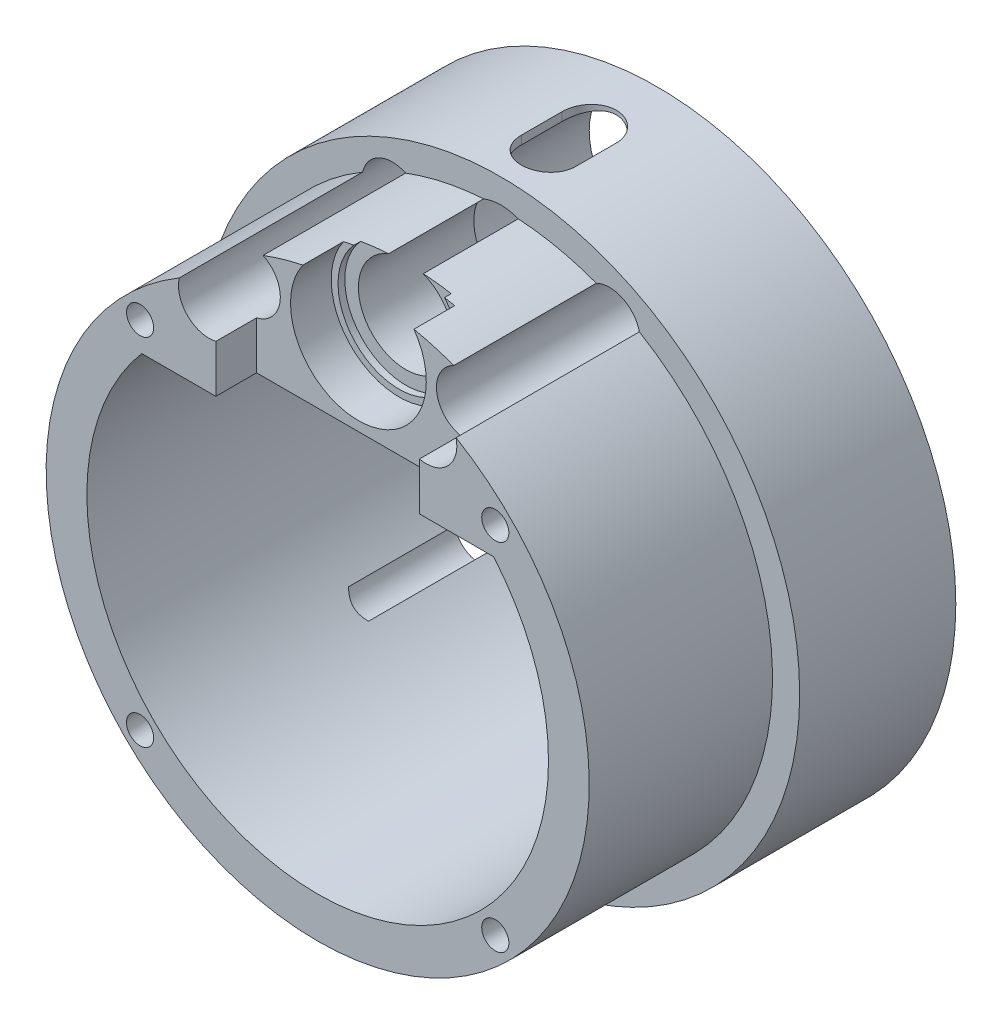
from build123d import *
from build123d.topology import SkipClean

# Parameters (mm, degrees)
SKIZZE1_R                                            = 22
AUFSATZ_LINEAR_AUSTRAGEN1_DEPTH                      = 1.5
AUFSATZ_LINEAR_START                                 = 13.5
SKIZZE1_6_R                                          = 20
AUFSATZ_LINEAR_AUSTRAGEN2_DEPTH                      = 13.5
SCHNITT_LINEAR_START                                 = 10.5
SCHNITT_LINEAR_AUSTRAGEN2_DEPTH                      = 3
SKIZZE1_9_R                                          = 5
SCHNITT_LINEAR_AUSTRAGEN3_DEPTH                      = 3
SCHNITT_LINEAR_START_2                               = 7
SCHNITT_LINEAR_AUSTRAGEN4_DEPTH                      = 0.5
SCHNITT_LINEAR_AUSTRAGEN5_DEPTH                      = 34.915335764
SCHNITT_LINEAR_AUSTRAGEN5_DEPTH_BACK                 = 34.915335764
SKIZZE1_11_R                                         = 3.5
SKIZZE3_R                                            = 0.75
SCHNITT_LINEAR_AUSTRAGEN6_DEPTH                      = 8
FORMSENKUNG_F_R_M3_SENKSCHRAUBE_MIT_INNE_D           = 2
FORMSENKUNG_F_R_M3_SENKSCHRAUBE_MIT_INNE_CSINK_D     = 3.7
FORMSENKUNG_F_R_M3_SENKSCHRAUBE_MIT_INNE_CSINK_ANGLE = 90
SKIZZE9_R                                            = 22
SKIZZE9_R_2                                          = 5
SKIZZE9_R_3                                          = 1.85
AUFSATZ_LINEAR_AUSTRAGEN5_DEPTH                      = 10
SKIZZE12_R                                           = 1.3
SCHNITT_LINEAR_AUSTRAGEN8_DEPTH                      = 40.912404087
SKIZZE12_3_R                                         = 2.25
SKIZZE12_3_R_2                                       = 1.3
SCHNITT_LINEAR_AUSTRAGEN9_DEPTH                      = 19
SCHNITT_LINEAR_AUSTRAGEN11_DEPTH                     = 5


# Read off the part's stored shape, not the designer's step: Schnitt-Linear austragen4
with BuildPart() as part:
    # Skizze1 → Aufsatz-Linear austragen1 (new body)
    with BuildSketch(Plane.XY):
        Circle(SKIZZE1_R)
        with BuildLine():
            Line((-12.961481397, 11), (12.961481397, 11))
            ThreePointArc((12.961481397, 11), (0, -17), (-12.961481397, 11))
        make_face(mode=Mode.SUBTRACT)
    extrude(amount=-AUFSATZ_LINEAR_AUSTRAGEN1_DEPTH)

    # Skizze1<6> → Aufsatz-Linear austragen2 (add)
    with BuildSketch(Plane.XY.offset(AUFSATZ_LINEAR_START)):
        Circle(SKIZZE1_6_R)
        with BuildLine():
            ThreePointArc((12.961481397, 11), (0, -17), (-12.961481397, 11))
            Line((-12.961481397, 11), (12.961481397, 11))
        make_face(mode=Mode.SUBTRACT)
    extrude(amount=-AUFSATZ_LINEAR_AUSTRAGEN2_DEPTH)

    # Skizze1<8> → Schnitt-Linear austragen2 (cut)
    with BuildSketch(Plane.XY.offset(SCHNITT_LINEAR_START)):
        with BuildLine():
            Line((-7.5, 18.540496218), (-7.5, 11))
            Line((-7.5, 11), (7.5, 11))
            Line((7.5, 11), (7.5, 18.540496218))
            ThreePointArc((7.5, 18.540496218), (0, 20), (-7.5, 18.540496218))
        make_face()
    extrude(amount=SCHNITT_LINEAR_AUSTRAGEN2_DEPTH, mode=Mode.SUBTRACT)

    # Skizze1<9> → Schnitt-Linear austragen3 (cut)
    with BuildSketch(Plane.XY.offset(SCHNITT_LINEAR_START)):
        with Locations((0, 16.7)):
            Circle(SKIZZE1_9_R)
    extrude(amount=-SCHNITT_LINEAR_AUSTRAGEN3_DEPTH, mode=Mode.SUBTRACT)

    # Schnitt-Linear austragen4 outline → Schnitt-Linear austragen4 (cut)
    with BuildSketch(Plane.XY.offset(SCHNITT_LINEAR_START_2)):
        with BuildLine():
            ThreePointArc((3.336322324, 19.719760479), (0, 20), (-3.336322324, 19.719760479))
            ThreePointArc((-3.336322324, 19.719760479), (0, 12.2), (3.336322324, 19.719760479))
        make_face()
    extrude(amount=SCHNITT_LINEAR_AUSTRAGEN4_DEPTH, mode=Mode.SUBTRACT)

    # Skizze1<11> → Schnitt-Linear austragen5 (cut, two sides: drawn at the far end of the back side and taken through both)
    with BuildSketch(Plane.XY.offset(-SCHNITT_LINEAR_AUSTRAGEN5_DEPTH_BACK)):
        with Locations((0, 16.7)):
            Circle(SKIZZE1_11_R)
    extrude(amount=SCHNITT_LINEAR_AUSTRAGEN5_DEPTH + SCHNITT_LINEAR_AUSTRAGEN5_DEPTH_BACK, mode=Mode.SUBTRACT)

    # Skizze3 → Schnitt-Linear austragen6 (cut)
    with BuildSketch(Plane(origin=(0, 0, 13.5), x_dir=(-1, 0, 0), z_dir=(0, 0, -1))):
        with Locations((-13.081475452, 13.081475452)):
            Circle(SKIZZE3_R)
        with Locations((13.081475452, 13.081475452)):
            Circle(SKIZZE3_R)
        with Locations((13.081475452, -13.081475452)):
            Circle(SKIZZE3_R)
        with Locations((-13.081475452, -13.081475452)):
            Circle(SKIZZE3_R)
    extrude(amount=SCHNITT_LINEAR_AUSTRAGEN6_DEPTH, mode=Mode.SUBTRACT)

    # Formsenkung für M3 Senkschraube mit Innensechskant1 (through all)
    with Locations(Plane(origin=(0, 0, -1.5), x_dir=(-1, 0, 0), z_dir=(0, 0, -1))):
        with Locations((-13.081475452, 13.081475452), (13.081475452, 13.081475452), (13.081475452, -13.081475452), (-13.081475452, -13.081475452)):
            CounterSinkHole(FORMSENKUNG_F_R_M3_SENKSCHRAUBE_MIT_INNE_D / 2, FORMSENKUNG_F_R_M3_SENKSCHRAUBE_MIT_INNE_CSINK_D / 2, counter_sink_angle=FORMSENKUNG_F_R_M3_SENKSCHRAUBE_MIT_INNE_CSINK_ANGLE)

    # Skizze9 → Aufsatz-Linear austragen5 (add)
    with BuildSketch(Plane(origin=(0, 0, -1.5), x_dir=(-1, 0, 0), z_dir=(0, 0, -1))):
        with Locations(Location((0, 0, 0), (0, 0, 180))):
            Circle(SKIZZE9_R)
        with Locations((0, 16.7)):
            Circle(SKIZZE9_R_2, mode=Mode.SUBTRACT)
        with Locations((13.081475452, 13.081475452)):
            Circle(SKIZZE9_R_3, mode=Mode.SUBTRACT)
        with Locations((-13.081475452, 13.081475452)):
            Circle(SKIZZE9_R_3, mode=Mode.SUBTRACT)
        with BuildLine():
            ThreePointArc((12.961481397, 11), (16.999097396, -0.175179101), (12.732038414, -11.264776865))
            ThreePointArc((12.732038414, -11.264776865), (14.389622997, -14.389622997), (11.264776865, -12.732038414))
            ThreePointArc((11.264776865, -12.732038414), (0, -17), (-11.264776865, -12.732038414))
            ThreePointArc((-11.264776865, -12.732038414), (-14.389622997, -14.389622997), (-12.732038414, -11.264776865))
            ThreePointArc((-12.732038414, -11.264776865), (-16.999097396, -0.175179101), (-12.961481397, 11))
            Line((-12.961481397, 11), (12.961481397, 11))
        make_face(mode=Mode.SUBTRACT)
    extrude(amount=AUFSATZ_LINEAR_AUSTRAGEN5_DEPTH)

    # Skizze12 → Schnitt-Linear austragen8 (cut, through all)
    with BuildSketch(Plane.XY.offset(13.5)):
        with Locations((-8, 16.7)):
            Circle(SKIZZE12_R)
        with Locations((8, 16.7)):
            Circle(SKIZZE12_R)
    extrude(amount=-SCHNITT_LINEAR_AUSTRAGEN8_DEPTH, mode=Mode.SUBTRACT)

    # Skizze12<3> → Schnitt-Linear austragen9 (cut)
    # profile 1 of 2: a face of its own
    with BuildSketch(Plane.XY.offset(13.5)):
        with Locations(Location((-8, 16.7, 0), (0, 0, 64.250049819))):
            Circle(SKIZZE12_3_R)
        with Locations((-8, 16.7)):
            Circle(SKIZZE12_3_R_2, mode=Mode.SUBTRACT)
    # profile 2 of 2: a face of its own
    with BuildSketch(Plane.XY.offset(13.5)):
        with Locations(Location((8, 16.7, 0), (0, 0, 13.057301294))):
            Circle(SKIZZE12_3_R)
        with Locations((8, 16.7)):
            Circle(SKIZZE12_3_R_2, mode=Mode.SUBTRACT)
    extrude(amount=-SCHNITT_LINEAR_AUSTRAGEN9_DEPTH, mode=Mode.SUBTRACT)

    # Skizze14 → Schnitt-Linear austragen11 (cut)
    with SkipClean():  # the faces are left unmerged after this step: merging them gives an invalid solid
        with BuildSketch(Plane(origin=(0, 22, 0), x_dir=(1, 0, 0), z_dir=(0, 1, 0))):
            with BuildLine():
                Line((2, 6.5), (2, 3.5))
                ThreePointArc((2, 3.5), (0, 1.5), (-2, 3.5))
                Line((-2, 3.5), (-2, 6.5))
                ThreePointArc((-2, 6.5), (0, 8.5), (2, 6.5))
            make_face()
        extrude(amount=-SCHNITT_LINEAR_AUSTRAGEN11_DEPTH, mode=Mode.SUBTRACT)


solid = part.part
